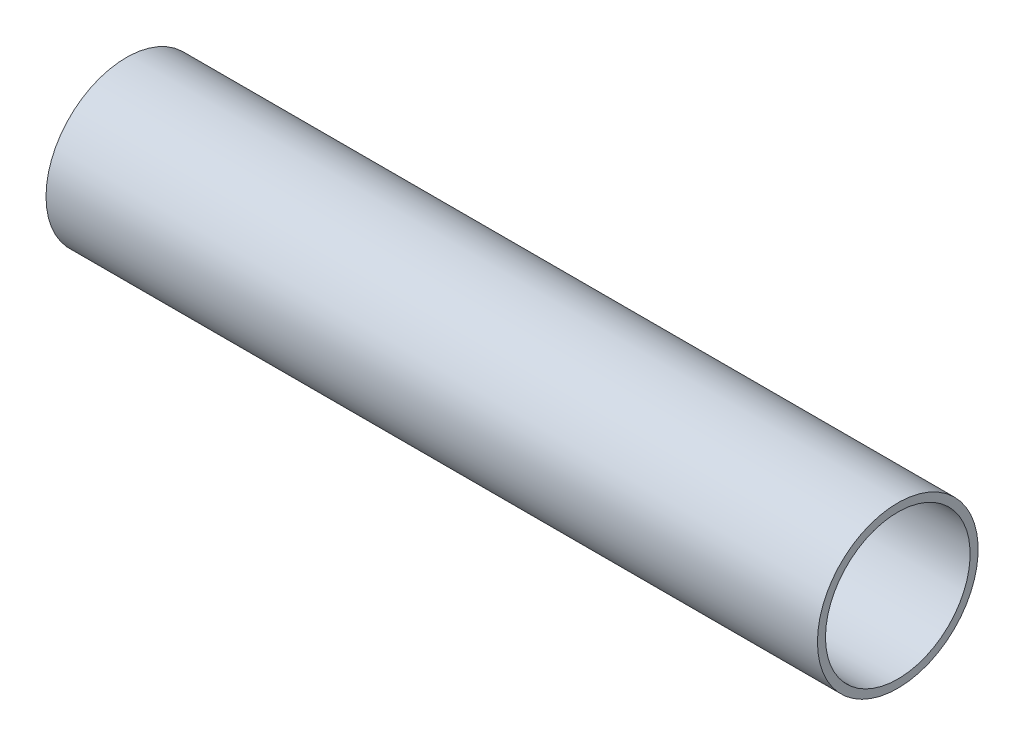
from build123d import *

# Parameters (mm, degrees)
SKETCH1_R           = 15.875
SKETCH1_R_2         = 14.2875
BOSS_EXTRUDE1_DEPTH = 76.2


with BuildPart() as part:
    # Sketch1 → Boss-Extrude1 (new, symmetric)
    with BuildSketch(Plane(origin=(0, 0, 0), x_dir=(0, 0, -1), z_dir=(1, 0, 0))):
        Circle(SKETCH1_R)
        Circle(SKETCH1_R_2, mode=Mode.SUBTRACT)
    extrude(amount=BOSS_EXTRUDE1_DEPTH, both=True)


solid = part.part
